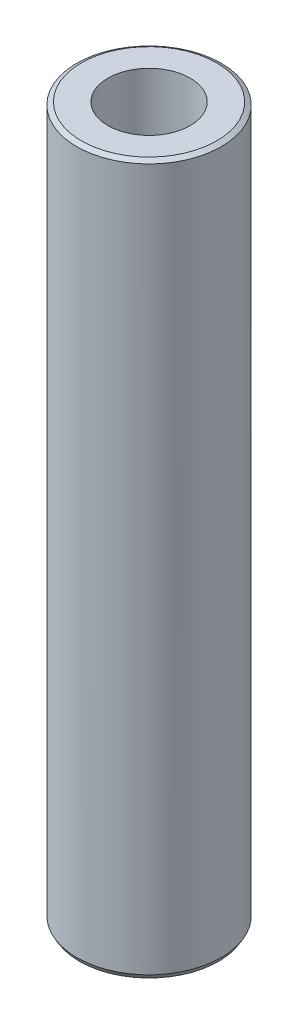
from build123d import *
from OCP.BRepFilletAPI import BRepFilletAPI_MakeChamfer

# Parameters (mm, degrees)
SKETCH1_R           = 50
BOSS_EXTRUDE1_DEPTH = 490.777688378
SKETCH2_R           = 28.461859068
CUT_EXTRUDE1_DEPTH  = 496.845479368
CHAMFER1_SIZE       = 1.862425394
CHAMFER1_SIZE2      = 3.225815407


with BuildPart() as part:
    # Sketch1 → Boss-Extrude1 (new body)
    with BuildSketch(Plane(origin=(0, 0, 0), x_dir=(1, 0, 0), z_dir=(0, 1, 0))):
        Circle(SKETCH1_R)
    extrude(amount=BOSS_EXTRUDE1_DEPTH)

    # Sketch2 → Cut-Extrude1 (cut, through all)
    with BuildSketch(Plane(origin=(0, 0, 0), x_dir=(1, 0, 0), z_dir=(0, 1, 0))):
        Circle(SKETCH2_R)
    extrude(amount=CUT_EXTRUDE1_DEPTH, mode=Mode.SUBTRACT)

    # Chamfer1: one chamfer whose edges measure the first distance from different faces: ONE call of the kernel's chamfer builder (chamfer() names one face for all edges)
    chamfer1_edges_1 = [part.edges().sort_by_distance(p)[0] for p in [
        (-50, 490.777688378, 0),
    ]]
    chamfer1_side_1 = [part.faces().sort_by_distance(p)[0] for p in [
        (-50, 245.388844189, 0),
    ]]
    chamfer1_edges_2 = [part.edges().sort_by_distance(p)[0] for p in [
        (-50, 0, 0),
    ]]
    chamfer1_side_2 = [part.faces().sort_by_distance(p)[0] for p in [
        (-48.585786438, 0, 0),
    ]]
    chamfer1 = BRepFilletAPI_MakeChamfer(part.part.solid().wrapped)
    for e in chamfer1_edges_1:
        chamfer1.Add(CHAMFER1_SIZE, CHAMFER1_SIZE2, e.wrapped, chamfer1_side_1[0].wrapped)  # the first distance lies on this face
    for e in chamfer1_edges_2:
        chamfer1.Add(CHAMFER1_SIZE, CHAMFER1_SIZE2, e.wrapped, chamfer1_side_2[0].wrapped)  # the first distance lies on this face
    add(Compound.cast(chamfer1.Shape()), mode=Mode.REPLACE)


solid = part.part
